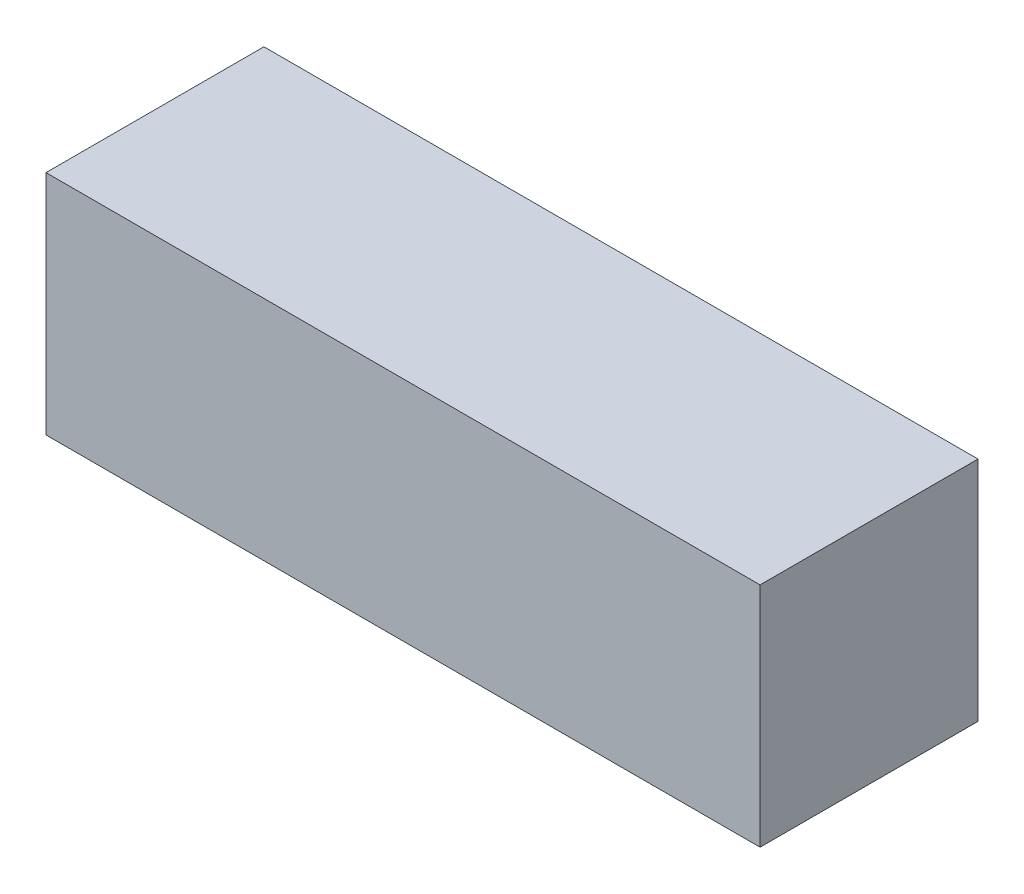
from build123d import *

# Parameters (mm, degrees)
SKETCH1_W           = 154
SKETCH1_H           = 47
BOSS_EXTRUDE1_DEPTH = 49


with BuildPart() as part:
    # Sketch1 → Boss-Extrude1 (new body)
    with BuildSketch(Plane(origin=(0, 0, 0), x_dir=(1, 0, 0), z_dir=(0, 1, 0))):
        Rectangle(SKETCH1_W, SKETCH1_H)
    extrude(amount=BOSS_EXTRUDE1_DEPTH)


solid = part.part
